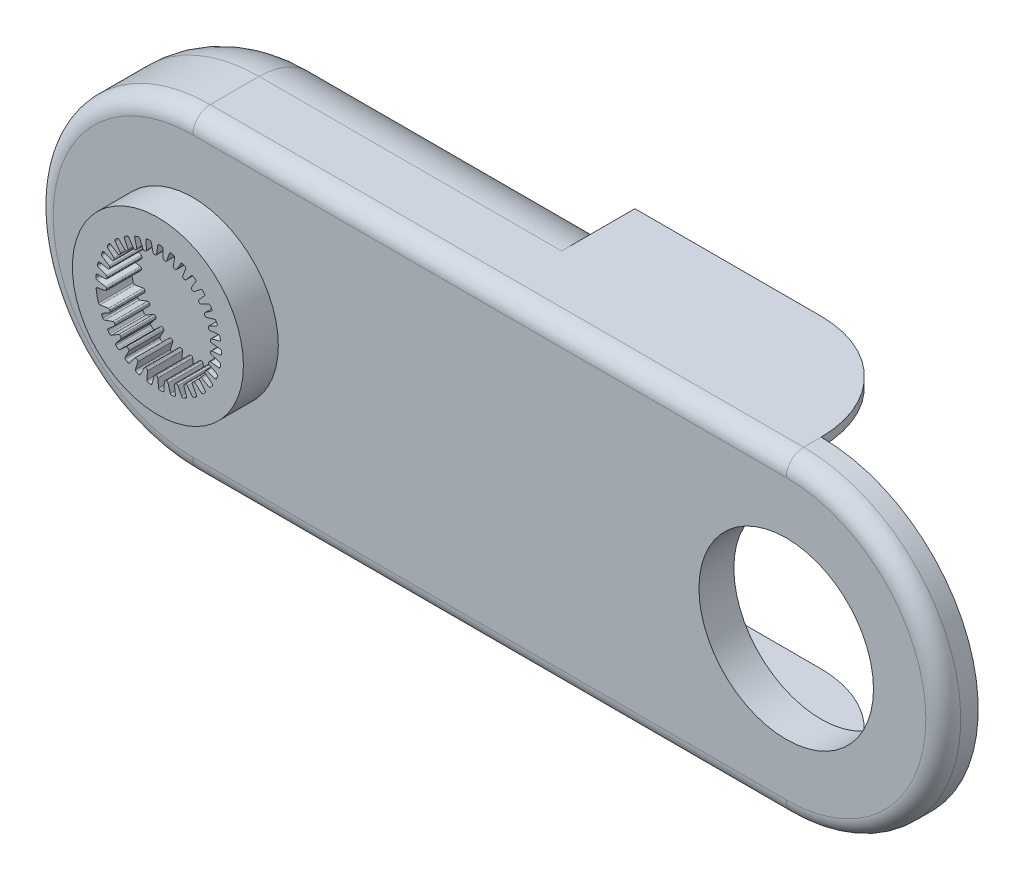
from build123d import *

# Parameters (mm, degrees)
SKETCH1_R           = 24.5
BOSS_EXTRUDE1_DEPTH = 10
BOSS_EXTRUDE3_DEPTH = 40
CUT_EXTRUDE3_DEPTH  = 30
FILLET12_R          = 5
FILLET14_R          = 30
SKETCH8_W           = 148.27581146
SKETCH8_H           = 90
CUT_EXTRUDE4_DEPTH  = 1
FILLET16_R          = 20
SKETCH9_R           = 25
CUT_EXTRUDE5_DEPTH  = 222.337274565


with BuildPart() as part:
    # Sketch1 → Boss-Extrude1 (new body)
    with BuildSketch(Plane.XY):
        with Locations((-0.371975008, 0)):
            Circle(SKETCH1_R)
        with BuildLine():
            Line((-16.969142825, -5.497864624), (-14.564977721, -5.124585631))
            ThreePointArc((-14.564977721, -5.124585631), (-14.29707046, -5.177296982), (-14.125400218, -5.389622476))
            Line((-14.125400218, -5.389622476), (-14.049847687, -5.60904296))
            ThreePointArc((-14.049847687, -5.60904296), (-14.054138659, -5.881349365), (-14.231761388, -6.087793926))
            Line((-14.231761388, -6.087793926), (-16.278130424, -7.240339372))
            ThreePointArc((-16.278130424, -7.240339372), (-16.462911631, -7.467282264), (-16.443705401, -7.759306734))
            ThreePointArc((-16.443705401, -7.759306734), (-16.284490349, -8.088614134), (-16.11861668, -8.414618309))
            ThreePointArc((-16.11861668, -8.414618309), (-15.909353928, -8.602256969), (-15.62830969, -8.605904202))
            Line((-15.62830969, -8.605904202), (-13.33954086, -7.780747067))
            ThreePointArc((-13.33954086, -7.780747067), (-13.06649801, -7.781370848), (-12.857468219, -7.957039097))
            Line((-12.857468219, -7.957039097), (-12.741436398, -8.158012106))
            ThreePointArc((-12.741436398, -8.158012106), (-12.693690022, -8.426134232), (-12.828657842, -8.662677839))
            Line((-12.828657842, -8.662677839), (-14.617513276, -10.1845134))
            ThreePointArc((-14.617513276, -10.1845134), (-14.755596786, -10.442544627), (-14.681022533, -10.725539064))
            ThreePointArc((-14.681022533, -10.725539064), (-14.461897897, -11.018416496), (-14.236867265, -11.306780868))
            ThreePointArc((-14.236867265, -11.306780868), (-13.995646114, -11.451042861), (-13.719069526, -11.400997316))
            Line((-13.719069526, -11.400997316), (-11.62979923, -10.15428296))
            ThreePointArc((-11.62979923, -10.15428296), (-11.361653923, -10.102796248), (-11.122945516, -10.235352213))
            Line((-11.122945516, -10.235352213), (-10.970698069, -10.410492867))
            ThreePointArc((-10.970698069, -10.410492867), (-10.872668815, -10.664578395), (-10.960022248, -10.922529105))
            Line((-10.960022248, -10.922529105), (-12.425631454, -12.757733968))
            ThreePointArc((-12.425631454, -12.757733968), (-12.511943302, -13.037372011), (-12.384741304, -13.300937604))
            ThreePointArc((-12.384741304, -13.300937604), (-12.113758956, -13.546623101), (-11.837840254, -13.786751538))
            ThreePointArc((-11.837840254, -13.786751538), (-11.57352453, -13.882335867), (-11.311578572, -13.780436499))
            Line((-11.311578572, -13.780436499), (-9.49857837, -12.157976231))
            ThreePointArc((-9.49857837, -12.157976231), (-9.245183775, -12.056270938), (-8.985568244, -12.140843765))
            Line((-8.985568244, -12.140843765), (-8.802699599, -12.28371641))
            ThreePointArc((-8.802699599, -12.28371641), (-8.657989614, -12.514428808), (-8.694518802, -12.784308057))
            Line((-8.694518802, -12.784308057), (-9.783027044, -14.865446458))
            ThreePointArc((-9.783027044, -14.865446458), (-9.814395646, -15.15641584), (-9.63924002, -15.390867705))
            ThreePointArc((-9.63924002, -15.390867705), (-9.326357378, -15.580333398), (-9.009689414, -15.763402229))
            ThreePointArc((-9.009689414, -15.763402229), (-8.731991565, -15.806796587), (-8.494301608, -15.656787752))
            Line((-8.494301608, -15.656787752), (-7.02419134, -13.718199902))
            ThreePointArc((-7.02419134, -13.718199902), (-6.794858602, -13.570013254), (-6.523875683, -13.603495261))
            Line((-6.523875683, -13.603495261), (-6.317105464, -13.70884995))
            ThreePointArc((-6.317105464, -13.70884995), (-6.131032208, -13.907711545), (-6.115394864, -14.179602449))
            Line((-6.115394864, -14.179602449), (-6.786804216, -16.430201641))
            ThreePointArc((-6.786804216, -16.430201641), (-6.762076913, -16.721810507), (-6.545403865, -16.918533562))
            ThreePointArc((-6.545403865, -16.918533562), (-6.202118, -17.044817414), (-5.856336939, -17.164099659))
            ThreePointArc((-5.856336939, -17.164099659), (-5.575461147, -17.153709492), (-5.370761259, -16.96110336))
            Line((-5.370761259, -16.96110336), (-4.297561057, -14.777622566))
            ThreePointArc((-4.297561057, -14.777622566), (-4.100717154, -14.588399775), (-3.828324286, -14.569560645))
            Line((-3.828324286, -14.569560645), (-3.605250396, -14.633526053))
            ThreePointArc((-3.605250396, -14.633526053), (-3.384651249, -14.79322955), (-3.317421976, -15.057141307))
            Line((-3.317421976, -15.057141307), (-3.547061077, -17.394501596))
            ThreePointArc((-3.547061077, -17.394501596), (-3.467146489, -17.676034594), (-3.216917807, -17.827800126))
            ThreePointArc((-3.216917807, -17.827800126), (-2.855842975, -17.886261756), (-2.49365476, -17.937374314))
            ThreePointArc((-2.49365476, -17.937374314), (-2.219921985, -17.873581416), (-2.055733994, -17.645455421))
            Line((-2.055733994, -17.645455421), (-1.418879279, -15.297315067))
            ThreePointArc((-1.418879279, -15.297315067), (-1.261757363, -15.074009244), (-0.997963795, -15.003541232))
            Line((-0.997963795, -15.003541232), (-0.766783225, -15.023766911))
            ThreePointArc((-0.766783225, -15.023766911), (-0.519764242, -15.138443903), (-0.403413423, -15.384678908))
            Line((-0.403413423, -15.384678908), (-0.182844038, -17.722912511))
            ThreePointArc((-0.182844038, -17.722912511), (-0.050678678, -17.984024533), (0.223910828, -18.085255821))
            ThreePointArc((0.223910828, -18.085255821), (0.589506703, -18.073747021), (0.954793236, -18.054811727))
            ThreePointArc((0.954793236, -18.054811727), (1.21132451, -17.939960209), (1.328967414, -17.684696986))
            Line((1.328967414, -17.684696986), (1.506075012, -15.258180974))
            ThreePointArc((1.506075012, -15.258180974), (1.617701396, -15.008997633), (1.863202402, -14.889490132))
            Line((1.863202402, -14.889490132), (2.093994776, -14.865232876))
            ThreePointArc((2.093994776, -14.865232876), (2.358356726, -14.930669484), (2.519553706, -15.150179676))
            Line((2.519553706, -15.150179676), (3.182226615, -17.403366719))
            ThreePointArc((3.182226615, -17.403366719), (3.361786248, -17.634463038), (3.650646611, -17.681440275))
            ThreePointArc((3.650646611, -17.681440275), (4.007329478, -17.600383942), (4.362291644, -17.512096587))
            ThreePointArc((4.362291644, -17.512096587), (4.592195013, -17.35040674), (4.658969966, -17.077386096))
            Line((4.658969966, -17.077386096), (4.369822517, -14.661658296))
            ThreePointArc((4.369822517, -14.661658296), (4.431851587, -14.395753836), (4.650038942, -14.231598224))
            Line((4.650038942, -14.231598224), (4.871962507, -14.163749381))
            ThreePointArc((4.871962507, -14.163749381), (5.143953277, -14.177541097), (5.344073133, -14.362260434))
            Line((5.344073133, -14.362260434), (6.424499231, -16.447606133))
            ThreePointArc((6.424499231, -16.447606133), (6.644855104, -16.640194968), (6.937371968, -16.631191945))
            ThreePointArc((6.937371968, -16.631191945), (7.272035289, -16.483566546), (7.603629778, -16.329171304))
            ThreePointArc((7.603629778, -16.329171304), (7.798457298, -16.126584524), (7.811910612, -15.845838777))
            Line((7.811910612, -15.845838777), (7.067133021, -13.529666635))
            ThreePointArc((7.067133021, -13.529666635), (7.077285479, -13.256811885), (7.260141751, -13.054040163))
            Line((7.260141751, -13.054040163), (7.465041785, -12.945092882))
            ThreePointArc((7.465041785, -12.945092882), (7.734666902, -12.906732919), (7.966356105, -13.049873773))
            Line((7.966356105, -13.049873773), (9.42483445, -14.89075078))
            ThreePointArc((9.42483445, -14.89075078), (9.677889447, -15.037755333), (9.963314095, -14.973102872))
            ThreePointArc((9.963314095, -14.973102872), (10.263660453, -14.764332996), (10.559702617, -14.549503217))
            ThreePointArc((10.559702617, -14.549503217), (10.712295226, -14.313463684), (10.671932552, -14.035309014))
            Line((10.671932552, -14.035309014), (9.498892143, -11.903801741))
            ThreePointArc((9.498892143, -11.903801741), (9.456794931, -11.634022921), (9.597600949, -11.400086065))
            Line((9.597600949, -11.400086065), (9.777948272, -11.254043683))
            ThreePointArc((9.777948272, -11.254043683), (10.03530019, -11.164941603), (10.290045172, -11.261244173))
            Line((10.290045172, -11.261244173), (12.072983054, -12.790008296))
            ThreePointArc((12.072983054, -12.790008296), (12.349438509, -12.886026792), (12.617282831, -12.768100588))
            ThreePointArc((12.617282831, -12.768100588), (12.872275811, -12.505857615), (13.121887392, -12.238487357))
            ThreePointArc((13.121887392, -12.238487357), (13.226637979, -11.977668492), (13.133942467, -11.712325868))
            Line((13.133942467, -11.712325868), (11.575743353, -9.84380705))
            ThreePointArc((11.575743353, -9.84380705), (11.48294336, -9.587017353), (11.576525119, -9.330511522))
            Line((11.576525119, -9.330511522), (11.725692753, -9.152740458))
            ThreePointArc((11.725692753, -9.152740458), (11.961314913, -9.016170373), (12.229754908, -9.062095959))
            Line((12.229754908, -9.062095959), (14.271637147, -10.222571794))
            ThreePointArc((14.271637147, -10.222571794), (14.561334529, -10.264075972), (14.801756416, -10.097209299))
            ThreePointArc((14.801756416, -10.097209299), (15.002026138, -9.791129513), (15.196035002, -9.481043465))
            ThreePointArc((15.196035002, -9.481043465), (15.24909444, -9.205029223), (15.107472246, -8.962248828))
            Line((15.107472246, -8.962248828), (13.22137144, -7.42537837))
            ThreePointArc((13.22137144, -7.42537837), (13.08127866, -7.191013697), (13.124197438, -6.921364359))
            Line((13.124197438, -6.921364359), (13.236704125, -6.718396924))
            ThreePointArc((13.236704125, -6.718396924), (13.441938441, -6.539377188), (13.714209453, -6.533238226))
            Line((13.714209453, -6.533238226), (15.940005792, -7.282783352))
            ThreePointArc((15.940005792, -7.282783352), (16.232299988, -7.268248115), (16.436464985, -7.058572594))
            ThreePointArc((16.436464985, -7.058572594), (16.574652412, -6.719903092), (16.705929579, -6.378495562))
            ThreePointArc((16.705929579, -6.378495562), (16.705348165, -6.09742826), (16.520003287, -5.886131214))
            Line((16.520003287, -5.886131214), (14.375306757, -4.737382395))
            ThreePointArc((14.375306757, -4.737382395), (14.193068988, -4.534054623), (14.183747708, -4.261170214))
            Line((14.183747708, -4.261170214), (14.255459317, -4.040464575))
            ThreePointArc((14.255459317, -4.040464575), (14.422764326, -3.825573383), (14.688861583, -3.767595452))
            Line((14.688861583, -3.767595452), (17.016783726, -4.07866736))
            ThreePointArc((17.016783726, -4.07866736), (17.300934201, -4.008626814), (17.461340136, -3.763847105))
            ThreePointArc((17.461340136, -3.763847105), (17.532367484, -3.405032512), (17.596089091, -3.044848735))
            ThreePointArc((17.596089091, -3.044848735), (17.54188819, -2.76905637), (17.319631242, -2.597006915))
            Line((17.319631242, -2.597006915), (14.99514722, -1.878591239))
            ThreePointArc((14.99514722, -1.878591239), (14.777460905, -1.713771776), (14.716242083, -1.447679606))
            Line((14.716242083, -1.447679606), (14.744523527, -1.217345731))
            ThreePointArc((14.744523527, -1.217345731), (14.867751498, -0.974479394), (15.117897089, -0.866792932))
            Line((15.117897089, -0.866792932), (17.462404064, -0.727961087))
            ThreePointArc((17.462404064, -0.727961087), (17.727969528, -0.604988917), (17.838722184, -0.334099605))
            ThreePointArc((17.838722184, -0.334099605), (17.839979507, 0.031675211), (17.833804064, 0.397400053))
            ThreePointArc((17.833804064, 0.397400053), (17.727975323, 0.657783316), (17.476973277, 0.784263113))
            Line((17.476973277, 0.784263113), (15.0581164, 1.045947009))
            ThreePointArc((15.0581164, 1.045947009), (14.812980559, 1.166201766), (14.70211372, 1.415723972))
            Line((14.70211372, 1.415723972), (14.685925779, 1.647222319))
            ThreePointArc((14.685925779, 1.647222319), (14.760548624, 1.909139522), (14.985550789, 2.06257751))
            Line((14.985550789, 2.06257751), (17.260492203, 2.646211643))
            ThreePointArc((17.260492203, 2.646211643), (17.497714285, 2.817596748), (17.554743986, 3.104641663))
            ThreePointArc((17.554743986, 3.104641663), (17.486185083, 3.463936074), (17.410339511, 3.821763191))
            ThreePointArc((17.410339511, 3.821763191), (17.256771672, 4.057169404), (16.986247758, 4.133431962))
            Line((16.986247758, 4.133431962), (14.561900453, 3.928768337))
            ThreePointArc((14.561900453, 3.928768337), (14.298322759, 4.000039553), (14.141881775, 4.223822943))
            Line((14.141881775, 4.223822943), (14.081819284, 4.447979208))
            ThreePointArc((14.081819284, 4.447979208), (14.105094939, 4.719322965), (14.296685833, 4.912874302))
            Line((14.296685833, 4.912874302), (16.418467522, 5.919864718))
            ThreePointArc((16.418467522, 5.919864718), (16.618629347, 6.133365102), (16.6198405, 6.426017974))
            ThreePointArc((16.6198405, 6.426017974), (16.483984611, 6.765629479), (16.341255904, 7.102410286))
            ThreePointArc((16.341255904, 7.102410286), (16.145591916, 7.304189299), (15.865486706, 7.327432303))
            Line((15.865486706, 7.327432303), (13.52473315, 6.663941652))
            ThreePointArc((13.52473315, 6.663941652), (13.252398931, 6.68361042), (13.056132325, 6.873431931))
            Line((13.056132325, 6.873431931), (12.95440232, 7.082009351))
            ThreePointArc((12.95440232, 7.082009351), (12.925475505, 7.352808963), (13.076614998, 7.579361483))
            Line((13.076614998, 7.579361483), (14.967270753, 8.972705682))
            ThreePointArc((14.967270753, 8.972705682), (15.123017247, 9.220476139), (15.068365347, 9.507983253))
            ThreePointArc((15.068365347, 9.507983253), (14.870204584, 9.815432612), (14.665837397, 10.118791886))
            ThreePointArc((14.665837397, 10.118791886), (14.435267057, 10.279529201), (14.155873194, 10.248898572))
            Line((14.155873194, 10.248898572), (11.984725859, 9.150961278))
            ThreePointArc((11.984725859, 9.150961278), (11.713642209, 9.118304857), (11.484761921, 9.267189378))
            Line((11.484761921, 9.267189378), (11.345102535, 9.452523643))
            ThreePointArc((11.345102535, 9.452523643), (11.265036185, 9.712828408), (11.370170562, 9.964057294))
            Line((11.370170562, 9.964057294), (12.960227038, 11.692555961))
            ThreePointArc((12.960227038, 11.692555961), (13.065835198, 11.965492009), (12.957328464, 12.237288733))
            ThreePointArc((12.957328464, 12.237288733), (12.704144369, 12.501278525), (12.445648304, 12.760069138))
            ThreePointArc((12.445648304, 12.760069138), (12.188644066, 12.87385836), (11.920228055, 12.79047964))
            Line((11.920228055, 12.79047964), (9.998467123, 11.298440105))
            ThreePointArc((9.998467123, 11.298440105), (9.738595182, 11.214658475), (9.485511563, 11.317135151))
            Line((9.485511563, 11.317135151), (9.313054669, 11.472416036))
            ThreePointArc((9.313054669, 11.472416036), (9.184790873, 11.712660889), (9.240056903, 11.979334578))
            Line((9.240056903, 11.979334578), (10.47108647, 13.979472934))
            ThreePointArc((10.47108647, 13.979472934), (10.522675657, 14.267545366), (10.364301238, 14.513644357))
            ThreePointArc((10.364301238, 14.513644357), (10.065397221, 14.724474111), (9.76227088, 14.929186636))
            ThreePointArc((9.76227088, 14.929186636), (9.488276526, 14.99184651), (9.240701483, 14.858783502))
            Line((9.240701483, 14.858783502), (7.638943277, 13.027467663))
            ThreePointArc((7.638943277, 13.027467663), (7.399832204, 12.895639434), (7.131844973, 12.947942693))
            Line((7.131844973, 12.947942693), (6.932927607, 13.067464305))
            ThreePointArc((6.932927607, 13.067464305), (6.7611795, 13.278821297), (6.764546399, 13.551140695))
            Line((6.764546399, 13.551140695), (7.591314094, 15.749422391))
            ThreePointArc((7.591314094, 15.749422391), (7.586988632, 16.042045802), (7.384566095, 16.253403998))
            ThreePointArc((7.384566095, 16.253403998), (7.050925573, 16.40332664), (6.714307526, 16.546438787))
            ThreePointArc((6.714307526, 16.546438787), (6.433391152, 16.555666835), (6.215754379, 16.377809024))
            Line((6.215754379, 16.377809024), (4.992856518, 14.274509741))
            ThreePointArc((4.992856518, 14.274509741), (4.783292601, 14.099479023), (4.510249118, 14.09968695))
            Line((4.510249118, 14.09968695), (4.292180626, 14.17905739))
            ThreePointArc((4.292180626, 14.17905739), (4.0832592, 14.353760076), (4.034603248, 14.621718634))
            Line((4.034603248, 14.621718634), (4.426728971, 16.937366417))
            ThreePointArc((4.426728971, 16.937366417), (4.3666478, 17.223788175), (4.127615291, 17.392639084))
            ThreePointArc((4.127615291, 17.392639084), (3.771498096, 17.476145612), (3.413757585, 17.552398635))
            ThreePointArc((3.413757585, 17.552398635), (3.136241642, 17.507855766), (2.956540339, 17.29173865))
            Line((2.956540339, 17.29173865), (2.15743898, 14.993742987))
            ThreePointArc((2.15743898, 14.993742987), (1.985122778, 14.781941396), (1.717056198, 14.73004635))
            Line((1.717056198, 14.73004635), (1.487849644, 14.766349102))
            ThreePointArc((1.487849644, 14.766349102), (1.249431849, 14.897977919), (1.150540941, 15.151729331))
            Line((1.150540941, 15.151729331), (1.093615783, 17.499653257))
            ThreePointArc((1.093615783, 17.499653257), (0.979986625, 17.769348613), (0.713127543, 17.889487702))
            ThreePointArc((0.713127543, 17.889487702), (0.347619428, 17.903509616), (-0.018098145, 17.910101548))
            ThreePointArc((-0.018098145, 17.910101548), (-0.282016159, 17.81342452), (-0.417178752, 17.566989459))
            Line((-0.417178752, 17.566989459), (-0.763120125, 15.15873872))
            ThreePointArc((-0.763120125, 15.15873872), (-0.891856745, 14.91794904), (-1.145096145, 14.815857937))
            Line((-1.145096145, 14.815857937), (-1.37701842, 14.807759033))
            ThreePointArc((-1.37701842, 14.807759033), (-1.636171771, 14.891477199), (-1.781663826, 15.121697207))
            Line((-1.781663826, 15.121697207), (-2.285548115, 17.415621326))
            ThreePointArc((-2.285548115, 17.415621326), (-2.448549885, 17.658680152), (-2.733429633, 17.725692835))
            ThreePointArc((-2.733429633, 17.725692835), (-3.094897842, 17.669714891), (-3.455153952, 17.606403508))
            ThreePointArc((-3.455153952, 17.606403508), (-3.695776202, 17.461144777), (-3.781433452, 17.193447184))
            Line((-3.781433452, 17.193447184), (-3.661503004, 14.763434069))
            ThreePointArc((-3.661503004, 14.763434069), (-3.741929532, 14.502504268), (-3.97103631, 14.353968511))
            Line((-3.97103631, 14.353968511), (-4.197152176, 14.30176555))
            ThreePointArc((-4.197152176, 14.30176555), (-4.467518329, 14.334496787), (-4.654265334, 14.532725812))
            Line((-4.654265334, 14.532725812), (-5.586593206, 16.688358429))
            ThreePointArc((-5.586593206, 16.688358429), (-5.792977985, 16.895849376), (-6.085410312, 16.907273229))
            ThreePointArc((-6.085410312, 16.907273229), (-6.429556237, 16.783352371), (-6.771113046, 16.65246409))
            ThreePointArc((-6.771113046, 16.65246409), (-6.979597716, 16.463961282), (-7.012602092, 16.184837873))
            Line((-7.012602092, 16.184837873), (-6.431206742, 13.822354752))
            ThreePointArc((-6.431206742, 13.822354752), (-6.460367855, 13.550872862), (-6.656923338, 13.36135049))
            Line((-6.656923338, 13.36135049), (-6.868924024, 13.266961704))
            ThreePointArc((-6.868924024, 13.266961704), (-7.140568204, 13.247503281), (-7.361708022, 13.406457273))
            Line((-7.361708022, 13.406457273), (-8.688220498, 15.344588302))
            ThreePointArc((-8.688220498, 15.344588302), (-8.930404547, 15.508886984), (-9.219643842, 15.46430223))
            ThreePointArc((-9.219643842, 15.46430223), (-9.533821622, 15.276992009), (-9.84412841, 15.083336403))
            ThreePointArc((-9.84412841, 15.083336403), (-10.012814597, 14.858516172), (-9.991953333, 14.578223515))
            Line((-9.991953333, 14.578223515), (-8.970456822, 12.370081325))
            ThreePointArc((-8.970456822, 12.370081325), (-8.947280977, 12.098023119), (-9.104062609, 11.874478253))
            Line((-9.104062609, 11.874478253), (-9.294158016, 11.741372016))
            ThreePointArc((-9.294158016, 11.741372016), (-9.557098485, 11.670438947), (-9.804505193, 11.784277039))
            Line((-9.804505193, 11.784277039), (-11.476458734, 13.43368863))
            ThreePointArc((-11.476458734, 13.43368863), (-11.745542845, 13.548757787), (-12.020960828, 13.449802721))
            ThreePointArc((-12.020960828, 13.449802721), (-12.293625803, 13.20598597), (-12.561280149, 12.956679036))
            ThreePointArc((-12.561280149, 12.956679036), (-12.683969373, 12.703802544), (-12.610009029, 12.43264017))
            Line((-12.610009029, 12.43264017), (-11.185946893, 10.459978494))
            ThreePointArc((-11.185946893, 10.459978494), (-11.1112857, 10.197340923), (-11.222532441, 9.947987861))
            Line((-11.222532441, 9.947987861), (-11.383737393, 9.781055247))
            ThreePointArc((-11.383737393, 9.781055247), (-11.628312237, 9.661254011), (-11.892894719, 9.725793152))
            Line((-11.892894719, 9.725793152), (-13.848852332, 11.02587663))
            ThreePointArc((-13.848852332, 11.02587663), (-14.134948842, 11.087487974), (-14.386425104, 10.937798763))
            ThreePointArc((-14.386425104, 10.937798763), (-14.607558025, 10.646434682), (-14.822724802, 10.350637362))
            ThreePointArc((-14.822724802, 10.350637362), (-14.89490877, 10.078996716), (-14.770567065, 9.826928657))
            Line((-14.770567065, 9.826928657), (-12.996267369, 8.162234197))
            ThreePointArc((-12.996267369, 8.162234197), (-12.872864302, 7.918668046), (-12.934488319, 7.652669423))
            Line((-12.934488319, 7.652669423), (-13.060879237, 7.458044476))
            ThreePointArc((-13.060879237, 7.458044476), (-13.278101399, 7.293777246), (-13.550137405, 7.306645904))
            Line((-13.550137405, 7.306645904), (-15.71822619, 8.209628879))
            ThreePointArc((-15.71822619, 8.209628879), (-16.010822299, 8.215518462), (-16.229116186, 8.02059553))
            ThreePointArc((-16.229116186, 8.02059553), (-16.390591385, 7.692390478), (-16.545364153, 7.360972031))
            ThreePointArc((-16.545364153, 7.360972031), (-16.56439042, 7.080548838), (-16.394236369, 6.856837495))
            Line((-16.394236369, 6.856837495), (-14.334896879, 5.561280504))
            ThreePointArc((-14.334896879, 5.561280504), (-14.16728646, 5.345735764), (-14.177023341, 5.072865868))
            Line((-14.177023341, 5.072865868), (-14.263955911, 4.857700206))
            ThreePointArc((-14.263955911, 4.857700206), (-14.445843425, 4.655003085), (-14.715336818, 4.615728392))
            Line((-14.715336818, 4.615728392), (-17.015888981, 5.088430184))
            ThreePointArc((-17.015888981, 5.088430184), (-17.304233061, 5.038381589), (-17.481323225, 4.805387503))
            ThreePointArc((-17.481323225, 4.805387503), (-17.577207194, 4.452401581), (-17.665898729, 4.097540189))
            ThreePointArc((-17.665898729, 4.097540189), (-17.631068162, 3.818638777), (-17.421354184, 3.631504565))
            Line((-17.421354184, 3.631504565), (-15.152646632, 2.752691104))
            ThreePointArc((-15.152646632, 2.752691104), (-14.946987814, 2.573088104), (-14.90447977, 2.303373712))
            Line((-14.90447977, 2.303373712), (-14.9487596, 2.075573732))
            ThreePointArc((-14.9487596, 2.075573732), (-15.088628894, 1.841894954), (-15.34567697, 1.751920085))
            Line((-15.34567697, 1.751920085), (-17.694157264, 1.776970967))
            ThreePointArc((-17.694157264, 1.776970967), (-17.967653929, 1.672823261), (-18.09703308, 1.410319536))
            ThreePointArc((-18.09703308, 1.410319536), (-18.123802502, 1.045523436), (-18.143153778, 0.680258704))
            ThreePointArc((-18.143153778, 0.680258704), (-18.055746248, 0.413127482), (-17.814178415, 0.269446766))
            Line((-17.814178415, 0.269446766), (-15.419467897, -0.160330607))
            ThreePointArc((-15.419467897, -0.160330607), (-15.183317743, -0.297392242), (-15.090126759, -0.554040304))
            Line((-15.090126759, -0.554040304), (-15.090126759, -0.786103946))
            ThreePointArc((-15.090126759, -0.786103946), (-15.182838247, -1.042177706), (-15.417995612, -1.179546569))
            Line((-15.417995612, -1.179546569), (-17.728107642, -1.603067108))
            ThreePointArc((-17.728107642, -1.603067108), (-17.976707083, -1.757486951), (-18.053621104, -2.039854449))
            ThreePointArc((-18.053621104, -2.039854449), (-17.805412438, -3.642620368), (-17.413942426, -5.216538207))
            ThreePointArc((-17.413942426, -5.216538207), (-17.244327564, -5.440658632), (-16.969142825, -5.497864624))
        make_face(mode=Mode.SUBTRACT)
    extrude(amount=BOSS_EXTRUDE1_DEPTH)

    # Sketch6 → Boss-Extrude3 (add)
    with BuildSketch(Plane.XY):
        with BuildLine():
            Line((-0.371975008, 45), (169.628024992, 45))
            ThreePointArc((169.628024992, 45), (214.628024992, 0), (169.628024992, -45))
            Line((169.628024992, -45), (-0.371975008, -45))
            ThreePointArc((-0.371975008, -45), (-45.371975008, 0), (-0.371975008, 45))
        make_face()
    extrude(amount=-BOSS_EXTRUDE3_DEPTH)

    # Sketch7 → Cut-Extrude3 (cut)
    with BuildSketch(Plane(origin=(0, 0, -40), x_dir=(-1, 0, 0), z_dir=(0, 0, -1))):
        Polygon((-169.628024992, 42.5), (-91.437307777, 42.5), (-91.437307777, -42.5), (-169.628024992, -42.5), (-169.628024992, -45), (-257.061182099, -45), (-257.061182099, -42.5), (-257.061182099, 42.5), (-257.061182099, 45), (-169.628024992, 45), align=None)
    extrude(amount=-CUT_EXTRUDE3_DEPTH, mode=Mode.SUBTRACT)

    # Fillet12
    fillet12_edges = [part.edges().sort_by_distance(p)[0] for p in [
        (-45.371975008, 0, 0),
        (84.628024992, -45, 0),
        (214.628024992, 0, 0),
        (84.628024992, 45, 0),
    ]]
    fillet(fillet12_edges, radius=FILLET12_R)

    # Fillet14
    fillet14_edges = [part.edges().sort_by_distance(p)[0] for p in [
        (169.628024992, -43.75, -40),
        (169.628024992, 43.75, -40),
    ]]
    fillet(fillet14_edges, radius=FILLET14_R - 0.0001)  # a hair under: the kernel refuses the full size

    # Sketch8 → Cut-Extrude4 (cut)
    with BuildSketch(Plane(origin=(0, 0, -40), x_dir=(-1, 0, 0), z_dir=(0, 0, -1))):
        with Locations((-12.137628278, 0)):
            Rectangle(SKETCH8_W, SKETCH8_H)
    extrude(amount=-CUT_EXTRUDE4_DEPTH, mode=Mode.SUBTRACT)

    # Fillet16
    fillet16_edges = [part.edges().sort_by_distance(p)[0] for p in [
        (42.9517795, -45, -39),
        (42.9517795, 45, -39),
        (-45.371975008, 0, -39),
    ]]
    fillet(fillet16_edges, radius=FILLET16_R)

    # Sketch9 → Cut-Extrude5 (cut, through all)
    with BuildSketch(Plane(origin=(0, 0, -10), x_dir=(-1, 0, 0), z_dir=(0, 0, -1))):
        with Locations((-169.628024992, 0)):
            Circle(SKETCH9_R)
    extrude(amount=-CUT_EXTRUDE5_DEPTH, mode=Mode.SUBTRACT)


solid = part.part
